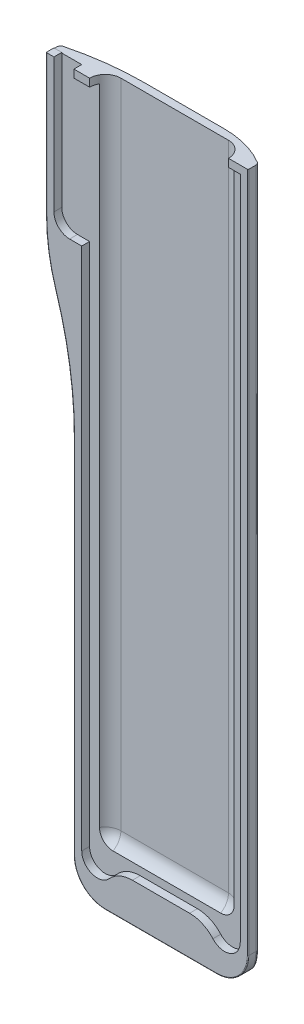
from build123d import *

# Parameters (mm, degrees)
EXTRUDE_1_DEPTH                 = 2
EXTRUDE_2_DEPTH                 = 4
CUT_EXTRUDE_1_DEPTH             = 188.59002480458167
CUT_EXTRUDE_2_DEPTH             = 2
CUT_EXTRUDE_2_DIRECTION_2_REACH = 189.537
FILLET_2_R                      = 4
FILLET_4_R                      = 4
FILLET_2_OF_MIRROR_2_R          = 4
FILLET_4_OF_MIRROR_2_R          = 4
SKETCH_5_W                      = 71.41231511226961
SKETCH_5_H                      = 207.27133175205378
CUT_EXTRUDE_3_DEPTH             = 6
FILLET_5_R                      = 1
FILLET_6_R                      = 0.2


with BuildPart() as part:
    # Эскиз1 → Бобышка-Вытянуть1 (new body)
    with BuildSketch(Plane.XY):
        with BuildLine():
            Line((1.9999999999999325, 143.85327479729386), (-1.1000000000000731, 143.85327479729386))
            ThreePointArc((-1.1000000000000731, 143.85327479729386), (-3.9284271247462668, 145.02484767254768), (-5.100000000000077, 147.85327479729386))
            Line((-5.100000000000077, 147.85327479729386), (-5.100000000000077, 182.13667232653498))
            Line((-5.100000000000077, 182.13667232653498), (-7.100000000000079, 182.13667232653498))
            Line((-7.100000000000079, 182.13667232653498), (-7.100000000000079, 145.99999999999997))
            ThreePointArc((-7.100000000000079, 145.99999999999997), (-6.504790590926916, 138.30801282719042), (-4.733333333333409, 130.7991593799699))
            ThreePointArc((-4.733333333333409, 130.7991593799699), (-1.190418818146398, 115.78145248552887), (-6.939e-14, 100.39747813990977))
            Line((-6.939e-14, 100.39747813990977), (-6.939e-14, 7.999999999999965))
            ThreePointArc((-6.939e-14, 7.999999999999965), (2.3431457505075475, 2.343145750507591), (7.999999999999924, -2.776e-14))
            Line((7.999999999999924, -2.776e-14), (36.499999999999936, -2.776e-14))
            ThreePointArc((36.499999999999936, -2.776e-14), (42.15685424949231, 2.343145750507591), (44.49999999999994, 7.999999999999965))
            Line((44.49999999999994, 7.999999999999965), (44.49999999999994, 182))
            Line((44.49999999999994, 182), (-6.939e-14, 182))
            Line((-6.939e-14, 182), (-6.939e-14, 180))
            Line((-6.939e-14, 180), (42.49999999999994, 180))
            Line((42.49999999999994, 180), (42.49999999999994, 9.999999999999968))
            ThreePointArc((42.49999999999994, 9.999999999999968), (39.927288359092294, 6.263310564149096), (35.518576030000204, 7.333333333333303))
            ThreePointArc((35.518576030000204, 7.333333333333303), (32.821714413711675, 9.302967433402177), (29.555728090000773, 9.999999999999968))
            Line((29.555728090000773, 9.999999999999968), (14.944271909999085, 9.999999999999968))
            ThreePointArc((14.944271909999085, 9.999999999999968), (11.67828558628818, 9.30296743340218), (8.98142396999964, 7.333333333333303))
            ThreePointArc((8.98142396999964, 7.333333333333303), (4.572711640907565, 6.263310564149116), (1.9999999999999325, 9.999999999999968))
            Line((1.9999999999999325, 9.999999999999968), (1.9999999999999325, 143.85327479729386))
        make_face()
    extrude_1 = extrude(amount=EXTRUDE_1_DEPTH)

    # Эскиз2 → Бобышка-Вытянуть2 (add)
    with BuildSketch(Plane.XY.offset(2)):
        with BuildLine():
            Line((-7.100000000000086, 182), (-7.100000000000079, 145.99999999999997))
            ThreePointArc((-7.100000000000079, 145.99999999999997), (-6.504790590926923, 138.30801282719045), (-4.733333333333409, 130.79915937996992))
            ThreePointArc((-4.733333333333409, 130.79915937996992), (-1.190418818146398, 115.78145248552889), (-6.939e-14, 100.39747813990977))
            Line((-6.939e-14, 100.39747813990977), (-6.939e-14, 7.999999999999965))
            ThreePointArc((-6.939e-14, 7.999999999999965), (2.3431457505075475, 2.343145750507591), (7.999999999999922, -2.776e-14))
            Line((7.999999999999922, -2.776e-14), (36.499999999999936, -2.776e-14))
            ThreePointArc((36.499999999999936, -2.776e-14), (42.15685424949231, 2.343145750507591), (44.499999999999936, 7.999999999999965))
            Line((44.499999999999936, 7.999999999999965), (44.49999999999994, 182))
            Line((44.49999999999994, 182), (-6.939e-14, 182))
            Line((-6.939e-14, 182), (-7.100000000000086, 182))
        make_face()
    extrude_2 = extrude(amount=EXTRUDE_2_DEPTH)

    # Эскиз3 → Вырез-Вытянуть1 (cut, through all)
    with BuildSketch(Plane(origin=(0, 0, 0), x_dir=(1, 0, 0), z_dir=(0, 1, 0))):
        with BuildLine():
            Line((44.499999999999936, -2.532866310674285), (44.49999999999994, -6))
            Line((44.49999999999994, -6), (32.49999999999994, -5.999999999999995))
            ThreePointArc((32.49999999999994, -5.999999999999995), (38.74541864128527, -5.115844790224724), (44.499999999999936, -2.532866310674285))
        make_face()
        with BuildLine():
            Line((11.99999999999994, -5.999999999999995), (-7.100000000000079, -6))
            Line((-7.100000000000079, -6), (-7.100000000000079, -3.4700000000000006))
            ThreePointArc((-7.100000000000079, -3.4700000000000006), (2.366582901171503, -5.364749639376697), (11.99999999999994, -5.999999999999995))
        make_face()
    cut_extrude_1 = extrude(amount=CUT_EXTRUDE_1_DEPTH, mode=Mode.SUBTRACT)

    # Эскиз4 → Вырез-Вытянуть2 (cut)
    with BuildSketch(Plane(origin=(0, 0, 2), x_dir=(-1, 0, 0), z_dir=(0, 0, -1))):
        Polygon((-39.499999999999936, 182.0150235796794), (-39.499999999999915, 11.999999999999964), (-3.999999999999927, 11.999999999999964), (-3.999999999999929, 182.0150235796794), align=None)
    cut_extrude_2 = extrude(amount=-CUT_EXTRUDE_2_DEPTH, mode=Mode.SUBTRACT)

    # Эскиз4 → Вырез-Вытянуть2 direction 2 (cut, up to next)
    with BuildSketch(Plane(origin=(0, 0, 2), x_dir=(-1, 0, 0), z_dir=(0, 0, -1)), mode=Mode.PRIVATE) as cut_extrude_2_direction_2_sk1:
        Polygon((-39.499999999999936, 182.0150235796794), (-39.499999999999915, 11.999999999999964), (-3.999999999999927, 11.999999999999964), (-3.999999999999929, 182.0150235796794), align=None)
    cut_extrude_2_direction_2_tool1 = extrude(cut_extrude_2_direction_2_sk1.sketch, amount=CUT_EXTRUDE_2_DIRECTION_2_REACH, mode=Mode.PRIVATE) & part.part
    cut_extrude_2_direction_2 = cut_extrude_2_direction_2_tool1.solids().sort_by_distance((21.75, 97.007512, 2))[0]
    add(cut_extrude_2_direction_2, mode=Mode.SUBTRACT)

    # Скругление2
    # the kernel refuses this fillet: 4 mm, written as the material it adds along each edge
    with BuildSketch(Plane(origin=(39.499999999999915, 11.999999999999964, 4), x_dir=(0, 1, 0), z_dir=(-1, 0, 0))) as fillet_2_piece_1:
        with BuildLine():
            CenterArc((3.464101615137942, 4), FILLET_2_R, 209.99999999999866, 60.000000000001364)
            Line((1.4033e-13, 2.000000000000081), (-0.06928203230261509, 1.9600000000000826))
            ThreePointArc((-0.06928203230261509, 1.9600000000000826), (-0.08000000000000007, 1.0000000000000404), (-0.08000000000000007, 0))
            Line((-0.08000000000000007, 0), (0, -0.08000000000000007))
            Line((0, -0.08000000000000007), (3.464101615137942, -0.08000000000000007))
            Line((3.464101615137942, -0.08000000000000007), (3.464101615137942, 0))
        make_face()
    extrude(amount=35.499999999999986)

    # Скругление4
    # the kernel refuses this fillet: 4 mm, written as the material it adds along each edge
    with BuildSketch(Plane(origin=(4, 15.464101615138, 0), x_dir=(0, 0.39498467563648765, -0.9186877086433336), z_dir=(0, 0.9186877086433336, 0.39498467563648765))) as fillet_4_piece_1_section:
        with BuildLine():
            CenterArc((4 - FILLET_4_R, -FILLET_4_R), FILLET_4_R, 0, 89.99999999999999)
            Line((4 - FILLET_4_R, 7.105e-14), (4, 7.105e-14))
            Line((4, 7.105e-14), (3.999999999999999, -FILLET_4_R))
        make_face()
    fillet_4_piece_1 = revolve(axis=Axis((4, 15.464101615138, 0), (-1, 0, 0)), revolution_arc=203.26501832381055, mode=Mode.PRIVATE)
    fillet_4_piece_1 = split(fillet_4_piece_1, bisect_by=Plane(origin=(5.173719676182817, 13.89896236799288, 2), z_dir=(0, 0, 1)), keep=Keep.TOP, mode=Mode.PRIVATE)
    add(fillet_4_piece_1)
    with BuildSketch(Plane(origin=(39.5, 15.464101615138, 0), x_dir=(0, 0.39498467563648765, -0.9186877086433336), z_dir=(0, 0.9186877086433336, 0.39498467563648765))) as fillet_4_piece_2_section:
        with BuildLine():
            CenterArc((4.000000000000001 - FILLET_4_R, FILLET_4_R), FILLET_4_R, 270.0000000000001, 89.99999999999989)
            Line((4.000000000000001 - FILLET_4_R, 8.527e-14), (4.000000000000001, 8.527e-14))
            Line((4.000000000000001, 8.527e-14), (3.999999999999999, FILLET_4_R))
        make_face()
    fillet_4_piece_2 = revolve(axis=Axis((39.5, 15.464101615138, 0), (-1, 0, 0)), revolution_arc=203.26501832381055, mode=Mode.PRIVATE)
    fillet_4_piece_2 = split(fillet_4_piece_2, bisect_by=Plane(origin=(38.326280323994034, 13.89896236803503, 2), z_dir=(0, 0, 1)), keep=Keep.TOP, mode=Mode.PRIVATE)
    add(fillet_4_piece_2)
    with BuildSketch(Plane(origin=(3.999999999999927, 15.464101615137999, 4), x_dir=(1, -1e-17, 0), z_dir=(1e-17, 1, 0))) as fillet_4_piece_3_section:
        with BuildLine():
            CenterArc((FILLET_4_R, FILLET_4_R), FILLET_4_R, 180, 90)
            Line((0, FILLET_4_R), (0, 0))
            Line((0, 0), (FILLET_4_R, 0))
        make_face()
    fillet_4_piece_3 = extrude(amount=166.53589838486198, mode=Mode.PRIVATE)
    fillet_4_piece_3 = split(fillet_4_piece_3, bisect_by=Plane(origin=(5.020480239879724, 97.73205080756905, 2), z_dir=(0, 0, 1)), keep=Keep.TOP, mode=Mode.PRIVATE)
    fillet_4_piece_3 = split(fillet_4_piece_3, bisect_by=Plane(origin=(5.020480239879725, 180, 3.342432942783186), z_dir=(0, -1, 0)), keep=Keep.TOP, mode=Mode.PRIVATE)
    add(fillet_4_piece_3)
    with BuildSketch(Plane(origin=(3.999999999999927, 15.464101615137999, 4), x_dir=(1, -1e-17, 0), z_dir=(1e-17, 1, 0))) as fillet_4_piece_4_section:
        with BuildLine():
            CenterArc((FILLET_4_R, FILLET_4_R), FILLET_4_R, 180, 90)
            Line((0, FILLET_4_R), (0, 0))
            Line((0, 0), (FILLET_4_R, 0))
        make_face()
    fillet_4_piece_4 = extrude(amount=166.53589838486198, mode=Mode.PRIVATE)
    fillet_4_piece_4 = split(fillet_4_piece_4, bisect_by=Plane(origin=(5.020480239879721, 181, 2), z_dir=(0, 0, 1)), keep=Keep.TOP, mode=Mode.PRIVATE)
    fillet_4_piece_4 = split(fillet_4_piece_4, bisect_by=Plane(origin=(5.020480239879721, 180, 3.342432942783191), z_dir=(0, 1, 0)), keep=Keep.TOP, mode=Mode.PRIVATE)
    add(fillet_4_piece_4)
    with BuildSketch(Plane(origin=(3.999999999999927, 15.464101615137999, 4), x_dir=(1, -1e-17, 0), z_dir=(1e-17, 1, 0))) as fillet_4_piece_5_section:
        with BuildLine():
            CenterArc((FILLET_4_R, FILLET_4_R), FILLET_4_R, 180, 90)
            Line((0, FILLET_4_R), (0, 0))
            Line((0, 0), (FILLET_4_R, 0))
        make_face()
    fillet_4_piece_5 = extrude(amount=166.53589838486198, mode=Mode.PRIVATE)
    fillet_4_piece_5 = split(fillet_4_piece_5, bisect_by=Plane(origin=(4.096033526737358, 181.00000000000003, 2), z_dir=(0, 0, -1)), keep=Keep.TOP, mode=Mode.PRIVATE)
    fillet_4_piece_5 = split(fillet_4_piece_5, bisect_by=Plane(origin=(4.096033526737358, 180, 1.3469968619230481), z_dir=(0, 1, 0)), keep=Keep.TOP, mode=Mode.PRIVATE)
    add(fillet_4_piece_5)
    with BuildSketch(Plane(origin=(39.499999999999936, 182, 4), x_dir=(-1, 1.3e-16, 0), z_dir=(-1.3e-16, -1, 0))) as fillet_4_piece_6_section:
        with BuildLine():
            CenterArc((FILLET_4_R, FILLET_4_R), FILLET_4_R, 180, 90)
            Line((0, FILLET_4_R), (0, 0))
            Line((0, 0), (FILLET_4_R, 0))
        make_face()
    fillet_4_piece_6 = extrude(amount=166.535898384862, mode=Mode.PRIVATE)
    fillet_4_piece_6 = split(fillet_4_piece_6, bisect_by=Plane(origin=(38.47951976012014, 181.00000000000003, 2), z_dir=(0, 0, 1)), keep=Keep.TOP, mode=Mode.PRIVATE)
    fillet_4_piece_6 = split(fillet_4_piece_6, bisect_by=Plane(origin=(38.47951976012014, 180, 3.3424329427831925), z_dir=(0, 1, 0)), keep=Keep.TOP, mode=Mode.PRIVATE)
    add(fillet_4_piece_6)
    with BuildSketch(Plane(origin=(39.499999999999936, 182, 4), x_dir=(-1, 1.3e-16, 0), z_dir=(-1.3e-16, -1, 0))) as fillet_4_piece_7_section:
        with BuildLine():
            CenterArc((FILLET_4_R, FILLET_4_R), FILLET_4_R, 180, 90)
            Line((0, FILLET_4_R), (0, 0))
            Line((0, 0), (FILLET_4_R, 0))
        make_face()
    fillet_4_piece_7 = extrude(amount=166.535898384862, mode=Mode.PRIVATE)
    fillet_4_piece_7 = split(fillet_4_piece_7, bisect_by=Plane(origin=(39.4039664732625, 181, 2), z_dir=(0, 0, -1)), keep=Keep.TOP, mode=Mode.PRIVATE)
    fillet_4_piece_7 = split(fillet_4_piece_7, bisect_by=Plane(origin=(39.4039664732625, 180, 1.3469968619230488), z_dir=(0, 1, 0)), keep=Keep.TOP, mode=Mode.PRIVATE)
    add(fillet_4_piece_7)
    with BuildSketch(Plane(origin=(39.499999999999936, 182, 4), x_dir=(-1, 1.3e-16, 0), z_dir=(-1.3e-16, -1, 0))) as fillet_4_piece_8_section:
        with BuildLine():
            CenterArc((FILLET_4_R, FILLET_4_R), FILLET_4_R, 180, 90)
            Line((0, FILLET_4_R), (0, 0))
            Line((0, 0), (FILLET_4_R, 0))
        make_face()
    fillet_4_piece_8 = extrude(amount=166.535898384862, mode=Mode.PRIVATE)
    fillet_4_piece_8 = split(fillet_4_piece_8, bisect_by=Plane(origin=(38.47951976012013, 97.73205080756867, 2), z_dir=(0, 0, 1)), keep=Keep.TOP, mode=Mode.PRIVATE)
    fillet_4_piece_8 = split(fillet_4_piece_8, bisect_by=Plane(origin=(38.47951976012013, 180, 3.3424329427831925), z_dir=(0, -1, 0)), keep=Keep.TOP, mode=Mode.PRIVATE)
    add(fillet_4_piece_8)


with BuildPart() as mirror_2_1:
    # Зеркальное отражение2: Бобышка-Вытянуть1, Бобышка-Вытянуть2 across plane
    add(extrude_1.mirror(Plane(origin=(-1.1000000000000731, 147.85327479729386, 0), x_dir=(1, 0, 0), z_dir=(0, 0, 1))))
    add(extrude_2.mirror(Plane(origin=(-1.1000000000000731, 147.85327479729386, 0), x_dir=(1, 0, 0), z_dir=(0, 0, 1))))

    # Mirror 2 2: Вырез-Вытянуть1, Вырез-Вытянуть2, Вырез-Вытянуть2 direction 2 across plane
    add(cut_extrude_1.mirror(Plane(origin=(-1.1000000000000731, 147.85327479729386, 0), x_dir=(1, 0, 0), z_dir=(0, 0, 1))), mode=Mode.SUBTRACT)
    add(cut_extrude_2.mirror(Plane(origin=(-1.1000000000000731, 147.85327479729386, 0), x_dir=(1, 0, 0), z_dir=(0, 0, 1))), mode=Mode.SUBTRACT)
    add(cut_extrude_2_direction_2.mirror(Plane(origin=(-1.1000000000000731, 147.85327479729386, 0), x_dir=(1, 0, 0), z_dir=(0, 0, 1))), mode=Mode.SUBTRACT)

    # Скругление2 of Зеркальное отражение2
    # the kernel refuses this fillet: 4 mm, written as the material it adds along each edge
    with BuildSketch(Plane(origin=(39.499999999999915, 11.999999999999964, -4), x_dir=(0, 1, 0), z_dir=(-1, 0, 0))) as fillet_2_of_mirror_2_piece_1:
        with BuildLine():
            CenterArc((3.464101615137942, -4), FILLET_2_OF_MIRROR_2_R, 90, 60.000000000001336)
            Line((1.4033e-13, -2.000000000000081), (-0.06928203230261509, -1.9600000000000826))
            ThreePointArc((-0.06928203230261509, -1.9600000000000826), (-0.08000000000000007, -1.0000000000000404), (-0.08000000000000007, 0))
            Line((-0.08000000000000007, 0), (0, 0.08000000000000007))
            Line((0, 0.08000000000000007), (3.464101615137942, 0.08000000000000007))
            Line((3.464101615137942, 0.08000000000000007), (3.464101615137942, 0))
        make_face()
    extrude(amount=35.499999999999986)

    # Скругление4 of Зеркальное отражение2
    # the kernel refuses this fillet: 4 mm, written as the material it adds along each edge
    with BuildSketch(Plane(origin=(4, 15.464101615138, 0), x_dir=(0, 0, -1), z_dir=(0, 1, 0))) as fillet_4_of_mirror_2_piece_1_section:
        with BuildLine():
            CenterArc((4 - FILLET_4_OF_MIRROR_2_R, -FILLET_4_OF_MIRROR_2_R), FILLET_4_OF_MIRROR_2_R, 0, 90)
            Line((4 - FILLET_4_OF_MIRROR_2_R, 0), (4, 0))
            Line((4, 0), (4, -FILLET_4_OF_MIRROR_2_R))
        make_face()
    fillet_4_of_mirror_2_piece_1 = revolve(axis=Axis((4, 15.464101615138, 0), (-1, 0, 0)), revolution_arc=203.26501832381055, mode=Mode.PRIVATE)
    fillet_4_of_mirror_2_piece_1 = split(fillet_4_of_mirror_2_piece_1, bisect_by=Plane(origin=(5.173719676092002, 13.898962368084668, -2), z_dir=(0, 0, -1)), keep=Keep.TOP, mode=Mode.PRIVATE)
    add(fillet_4_of_mirror_2_piece_1)
    with BuildSketch(Plane(origin=(39.5, 15.464101615138, 0), x_dir=(0, 0, -1), z_dir=(0, 1, 0))) as fillet_4_of_mirror_2_piece_2_section:
        with BuildLine():
            CenterArc((4 - FILLET_4_OF_MIRROR_2_R, FILLET_4_OF_MIRROR_2_R), FILLET_4_OF_MIRROR_2_R, 270, 90)
            Line((4 - FILLET_4_OF_MIRROR_2_R, 0), (4, 0))
            Line((4, 0), (4, FILLET_4_OF_MIRROR_2_R))
        make_face()
    fillet_4_of_mirror_2_piece_2 = revolve(axis=Axis((39.5, 15.464101615138, 0), (-1, 0, 0)), revolution_arc=203.26501832381092, mode=Mode.PRIVATE)
    fillet_4_of_mirror_2_piece_2 = split(fillet_4_of_mirror_2_piece_2, bisect_by=Plane(origin=(38.32628032412626, 13.89896236809713, -2), z_dir=(0, 0, -1)), keep=Keep.TOP, mode=Mode.PRIVATE)
    add(fillet_4_of_mirror_2_piece_2)
    with BuildSketch(Plane(origin=(3.999999999999927, 15.464101615138, -4), x_dir=(1, -1e-17, 0), z_dir=(1e-17, 1, 0))) as fillet_4_of_mirror_2_piece_3_section:
        with BuildLine():
            CenterArc((FILLET_4_OF_MIRROR_2_R, -FILLET_4_OF_MIRROR_2_R), FILLET_4_OF_MIRROR_2_R, 90, 90)
            Line((0, -FILLET_4_OF_MIRROR_2_R), (0, 0))
            Line((0, 0), (FILLET_4_OF_MIRROR_2_R, 0))
        make_face()
    fillet_4_of_mirror_2_piece_3 = extrude(amount=166.535898384862, mode=Mode.PRIVATE)
    fillet_4_of_mirror_2_piece_3 = split(fillet_4_of_mirror_2_piece_3, bisect_by=Plane(origin=(5.020480239879724, 97.73205080756907, -2), z_dir=(0, 0, -1)), keep=Keep.TOP, mode=Mode.PRIVATE)
    fillet_4_of_mirror_2_piece_3 = split(fillet_4_of_mirror_2_piece_3, bisect_by=Plane(origin=(5.020480239879725, 180, -3.3424329427831863), z_dir=(0, -1, 0)), keep=Keep.TOP, mode=Mode.PRIVATE)
    add(fillet_4_of_mirror_2_piece_3)
    with BuildSketch(Plane(origin=(3.999999999999927, 15.464101615138, -4), x_dir=(1, -1e-17, 0), z_dir=(1e-17, 1, 0))) as fillet_4_of_mirror_2_piece_4_section:
        with BuildLine():
            CenterArc((FILLET_4_OF_MIRROR_2_R, -FILLET_4_OF_MIRROR_2_R), FILLET_4_OF_MIRROR_2_R, 90, 90)
            Line((0, -FILLET_4_OF_MIRROR_2_R), (0, 0))
            Line((0, 0), (FILLET_4_OF_MIRROR_2_R, 0))
        make_face()
    fillet_4_of_mirror_2_piece_4 = extrude(amount=166.535898384862, mode=Mode.PRIVATE)
    fillet_4_of_mirror_2_piece_4 = split(fillet_4_of_mirror_2_piece_4, bisect_by=Plane(origin=(5.020480239879721, 181, -2), z_dir=(0, 0, -1)), keep=Keep.TOP, mode=Mode.PRIVATE)
    fillet_4_of_mirror_2_piece_4 = split(fillet_4_of_mirror_2_piece_4, bisect_by=Plane(origin=(5.02048023987972, 180, -3.342432942783191), z_dir=(0, 1, 0)), keep=Keep.TOP, mode=Mode.PRIVATE)
    add(fillet_4_of_mirror_2_piece_4)
    with BuildSketch(Plane(origin=(3.999999999999927, 15.464101615138, -4), x_dir=(1, -1e-17, 0), z_dir=(1e-17, 1, 0))) as fillet_4_of_mirror_2_piece_5_section:
        with BuildLine():
            CenterArc((FILLET_4_OF_MIRROR_2_R, -FILLET_4_OF_MIRROR_2_R), FILLET_4_OF_MIRROR_2_R, 90, 90)
            Line((0, -FILLET_4_OF_MIRROR_2_R), (0, 0))
            Line((0, 0), (FILLET_4_OF_MIRROR_2_R, 0))
        make_face()
    fillet_4_of_mirror_2_piece_5 = extrude(amount=166.535898384862, mode=Mode.PRIVATE)
    fillet_4_of_mirror_2_piece_5 = split(fillet_4_of_mirror_2_piece_5, bisect_by=Plane(origin=(4.096033526737358, 181.00000000000003, -2), z_dir=(0, 0, 1)), keep=Keep.TOP, mode=Mode.PRIVATE)
    fillet_4_of_mirror_2_piece_5 = split(fillet_4_of_mirror_2_piece_5, bisect_by=Plane(origin=(4.096033526737357, 180, -1.3469968619230483), z_dir=(0, 1, 0)), keep=Keep.TOP, mode=Mode.PRIVATE)
    add(fillet_4_of_mirror_2_piece_5)
    with BuildSketch(Plane(origin=(39.499999999999936, 182, -4), x_dir=(-1, 1.3e-16, 0), z_dir=(-1.3e-16, -1, 0))) as fillet_4_of_mirror_2_piece_6_section:
        with BuildLine():
            CenterArc((FILLET_4_OF_MIRROR_2_R, -FILLET_4_OF_MIRROR_2_R), FILLET_4_OF_MIRROR_2_R, 90, 90)
            Line((0, -FILLET_4_OF_MIRROR_2_R), (0, 0))
            Line((0, 0), (FILLET_4_OF_MIRROR_2_R, 0))
        make_face()
    fillet_4_of_mirror_2_piece_6 = extrude(amount=166.535898384862, mode=Mode.PRIVATE)
    fillet_4_of_mirror_2_piece_6 = split(fillet_4_of_mirror_2_piece_6, bisect_by=Plane(origin=(38.47951976012015, 181.00000000000003, -2), z_dir=(0, 0, -1)), keep=Keep.TOP, mode=Mode.PRIVATE)
    fillet_4_of_mirror_2_piece_6 = split(fillet_4_of_mirror_2_piece_6, bisect_by=Plane(origin=(38.47951976012015, 180, -3.342432942783193), z_dir=(0, 1, 0)), keep=Keep.TOP, mode=Mode.PRIVATE)
    add(fillet_4_of_mirror_2_piece_6)
    with BuildSketch(Plane(origin=(39.499999999999936, 182, -4), x_dir=(-1, 1.3e-16, 0), z_dir=(-1.3e-16, -1, 0))) as fillet_4_of_mirror_2_piece_7_section:
        with BuildLine():
            CenterArc((FILLET_4_OF_MIRROR_2_R, -FILLET_4_OF_MIRROR_2_R), FILLET_4_OF_MIRROR_2_R, 90, 90)
            Line((0, -FILLET_4_OF_MIRROR_2_R), (0, 0))
            Line((0, 0), (FILLET_4_OF_MIRROR_2_R, 0))
        make_face()
    fillet_4_of_mirror_2_piece_7 = extrude(amount=166.535898384862, mode=Mode.PRIVATE)
    fillet_4_of_mirror_2_piece_7 = split(fillet_4_of_mirror_2_piece_7, bisect_by=Plane(origin=(39.40396647326251, 181, -2), z_dir=(0, 0, 1)), keep=Keep.TOP, mode=Mode.PRIVATE)
    fillet_4_of_mirror_2_piece_7 = split(fillet_4_of_mirror_2_piece_7, bisect_by=Plane(origin=(39.40396647326251, 180, -1.3469968619230486), z_dir=(0, 1, 0)), keep=Keep.TOP, mode=Mode.PRIVATE)
    add(fillet_4_of_mirror_2_piece_7)
    with BuildSketch(Plane(origin=(39.499999999999936, 182, -4), x_dir=(-1, 1.3e-16, 0), z_dir=(-1.3e-16, -1, 0))) as fillet_4_of_mirror_2_piece_8_section:
        with BuildLine():
            CenterArc((FILLET_4_OF_MIRROR_2_R, -FILLET_4_OF_MIRROR_2_R), FILLET_4_OF_MIRROR_2_R, 90, 90)
            Line((0, -FILLET_4_OF_MIRROR_2_R), (0, 0))
            Line((0, 0), (FILLET_4_OF_MIRROR_2_R, 0))
        make_face()
    fillet_4_of_mirror_2_piece_8 = extrude(amount=166.535898384862, mode=Mode.PRIVATE)
    fillet_4_of_mirror_2_piece_8 = split(fillet_4_of_mirror_2_piece_8, bisect_by=Plane(origin=(38.47951976012014, 97.73205080756865, -2), z_dir=(0, 0, -1)), keep=Keep.TOP, mode=Mode.PRIVATE)
    fillet_4_of_mirror_2_piece_8 = split(fillet_4_of_mirror_2_piece_8, bisect_by=Plane(origin=(38.47951976012014, 180, -3.342432942783193), z_dir=(0, -1, 0)), keep=Keep.TOP, mode=Mode.PRIVATE)
    add(fillet_4_of_mirror_2_piece_8)


with BuildPart() as part_1:
    add(part.part)

    # Зеркальное отражение2 united with what the copies tou: union Зеркальное отражение2_1
    add(mirror_2_1.part)

    # Эскиз5 → Вырез-Вытянуть3 (cut)
    with BuildSketch(Plane.XY.offset(6)):
        with Locations((24.684494507851028, 97.24579188946335)):
            Rectangle(SKETCH_5_W, SKETCH_5_H)
    extrude(amount=-CUT_EXTRUDE_3_DEPTH, mode=Mode.SUBTRACT)

    # Скругление5
    fillet_5_edges = [part_1.edges().sort_by_distance(p)[0] for p in [
        (-7.100000000000085, 164, -3.470000000000014),
        (-6.503974980113256, 138.30277606325515, -3.628035817655751),
        (-1.1917205831498348, 115.78981122675737, -4.804205152846508),
        (44.499999999999936, 94.99999999999999, -2.5328663106742857),
        (42.12205566302682, 2.3085599316919567, -3.838781791288831),
        (34.508012565523025, 0, -5.910218328626367),
        (22.249999999999943, -2.776e-14, -6),
        (9.999255807876082, 0, -5.972712502562629),
        (2.346859618446225, 2.3394343241856745, -5.362134341955673),
        (-6.928e-14, 54.19873906995487, -5.011909136851287),
    ]]
    fillet(fillet_5_edges, radius=FILLET_5_R)

    # Скругление6
    fillet_6_edges = [part_1.edges().sort_by_distance(p)[0] for p in [
        (44.49999999999994, 94.99999999999997, 0),
        (42.15685424949231, 2.343145750507589, 0),
        (22.25000000000017, -2.809e-14, 0),
        (2.343145750507551, 2.3431457505075883, 0),
        (-7.022e-14, 54.19873906995487, 0),
        (-1.190418818146398, 115.78145248552879, 0),
        (-6.504790590926895, 138.3080128271903, 0),
        (-7.10000000000008, 164.06833616326747, 0),
    ]]
    fillet(fillet_6_edges, radius=FILLET_6_R)


solid = part_1.part
